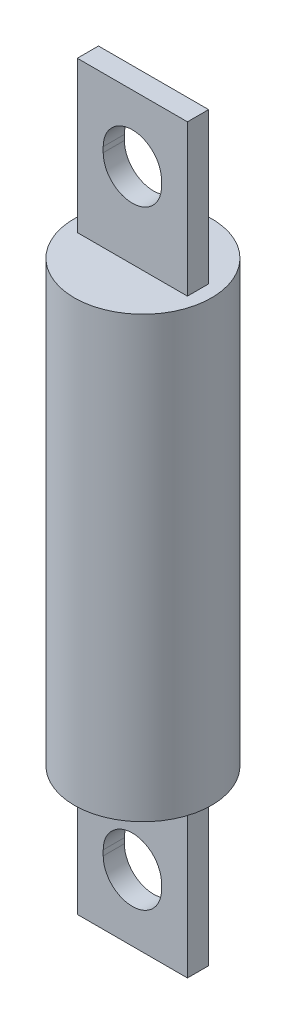
from build123d import *

# Parameters (mm, degrees)
SKETCH1_R           = 10.287
BOSS_EXTRUDE1_DEPTH = 65.8876
SKETCH2_W           = 16.51
SKETCH2_H           = 3.175
BOSS_EXTRUDE2_DEPTH = 22.6314
CUT_EXTRUDE1_DEPTH  = 90.902388624


with BuildPart() as part:
    # Sketch1 → Boss-Extrude1 (new body)
    with BuildSketch(Plane(origin=(0, 0, 0), x_dir=(1, 0, 0), z_dir=(0, 1, 0))):
        Circle(SKETCH1_R)
    extrude(amount=BOSS_EXTRUDE1_DEPTH)

    # Sketch2 → Boss-Extrude2 (add)
    with BuildSketch(Plane(origin=(0, 65.8876, 0), x_dir=(1, 0, 0), z_dir=(0, 1, 0))):
        Rectangle(SKETCH2_W, SKETCH2_H)
    boss_extrude2 = extrude(amount=BOSS_EXTRUDE2_DEPTH)

    # Sketch3 → Cut-Extrude1 (cut, through all)
    with BuildSketch(Plane.XY.offset(1.5875)):
        with BuildLine():
            Line((-4.3688, 78.98511), (-4.3688, 78.1939))
            ThreePointArc((-4.3688, 78.1939), (0, 73.8251), (4.3688, 78.1939))
            Line((4.3688, 78.1939), (4.3688, 78.98511))
            ThreePointArc((4.3688, 78.98511), (0, 83.35391), (-4.3688, 78.98511))
        make_face()
    cut_extrude1 = extrude(amount=-CUT_EXTRUDE1_DEPTH, mode=Mode.SUBTRACT)

    # Mirror2: Boss-Extrude2, Cut-Extrude1 across plane
    add(boss_extrude2.mirror(Plane.ZX.offset(32.9438)))
    add(cut_extrude1.mirror(Plane.ZX.offset(32.9438)), mode=Mode.SUBTRACT)


solid = part.part
